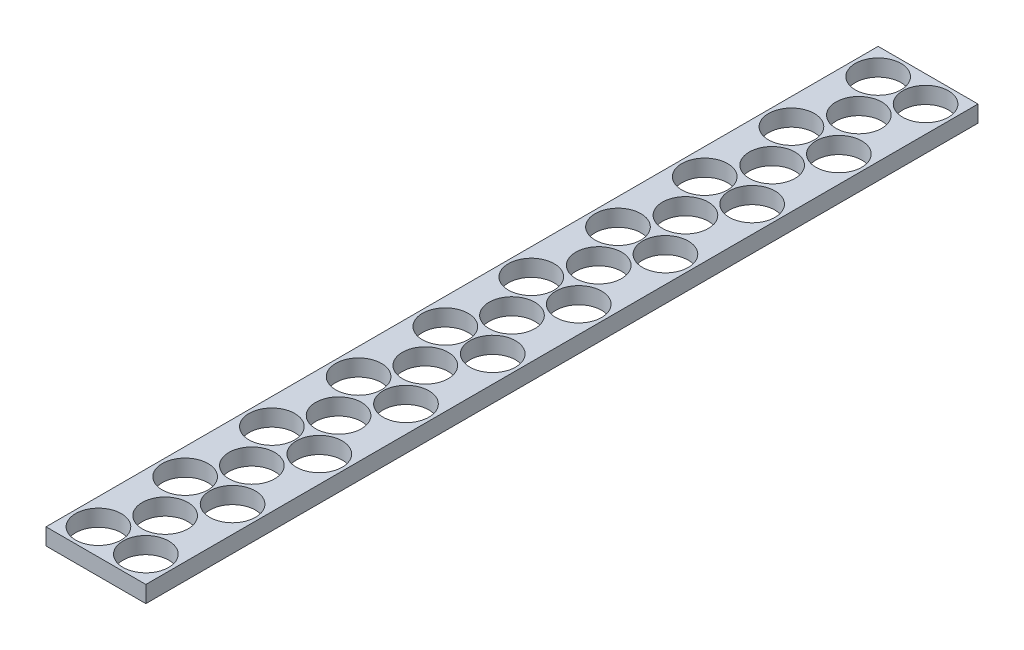
from build123d import *

# Parameters (mm, degrees)
SKETCH1_W           = 76.2
SKETCH1_H           = 12.7
BOSS_EXTRUDE1_DEPTH = 317.5
CUT_EXTRUDE1_REACH  = 322.03
SKETCH2_R           = 17.4625
LPATTERN1_COUNT     = 5
LPATTERN1_PITCH     = 66.173358604
MIRROR1_START       = -6.35
MIRROR1_OUTLINE_R   = 17.4625
MIRROR1_DEPTH       = 12.7


# Read off the part's stored shape, not the designer's step: Mirror1
with BuildPart() as part:
    # Sketch1 → Boss-Extrude1 (new, symmetric)
    with BuildSketch(Plane.XY):
        Rectangle(SKETCH1_W, SKETCH1_H)
    extrude(amount=BOSS_EXTRUDE1_DEPTH, both=True)

    # Sketch2 → Cut-Extrude1 (cut, up to next)
    with BuildSketch(Plane(origin=(0, 6.35, 0), x_dir=(1, 0, 0), z_dir=(0, 1, 0)), mode=Mode.PRIVATE) as cut_extrude1_sk1:
        with Locations(Location((-18.0975, -297.4975, 0), (0, 0, 180))):
            Circle(SKETCH2_R)
    cut_extrude1_tool1 = extrude(cut_extrude1_sk1.sketch, amount=-CUT_EXTRUDE1_REACH, mode=Mode.PRIVATE) & part.part
    # Sketch2 → Cut-Extrude1 (cut, up to next)
    with BuildSketch(Plane(origin=(0, 6.35, 0), x_dir=(1, 0, 0), z_dir=(0, 1, 0)), mode=Mode.PRIVATE) as cut_extrude1_sk2:
        with Locations(Location((0, -264.693434417, 0), (0, 0, 180))):
            Circle(SKETCH2_R)
    cut_extrude1_tool2 = extrude(cut_extrude1_sk2.sketch, amount=-CUT_EXTRUDE1_REACH, mode=Mode.PRIVATE) & part.part
    # Sketch2 → Cut-Extrude1 (cut, up to next)
    with BuildSketch(Plane(origin=(0, 6.35, 0), x_dir=(1, 0, 0), z_dir=(0, 1, 0)), mode=Mode.PRIVATE) as cut_extrude1_sk3:
        with Locations(Location((18.0975, -297.4975, 0), (0, 0, 180))):
            Circle(SKETCH2_R)
    cut_extrude1_tool3 = extrude(cut_extrude1_sk3.sketch, amount=-CUT_EXTRUDE1_REACH, mode=Mode.PRIVATE) & part.part
    cut_extrude1_1 = cut_extrude1_tool1.solids().sort_by_distance((-18.0975, 6.35, 297.4975))[0]
    add(cut_extrude1_1, mode=Mode.SUBTRACT)
    cut_extrude1_2 = cut_extrude1_tool2.solids().sort_by_distance((0, 6.35, 264.693434))[0]
    add(cut_extrude1_2, mode=Mode.SUBTRACT)
    cut_extrude1_3 = cut_extrude1_tool3.solids().sort_by_distance((18.0975, 6.35, 297.4975))[0]
    add(cut_extrude1_3, mode=Mode.SUBTRACT)
    cut_extrude1 = cut_extrude1_1 + cut_extrude1_2 + cut_extrude1_3  # Cut-Extrude1 as one shape, for the pattern or mirror that repeats it

    # LPattern1: Cut-Extrude1 ×5
    with Locations(*[(0, 0, -i * LPATTERN1_PITCH) for i in range(1, LPATTERN1_COUNT)]):
        add(cut_extrude1, mode=Mode.SUBTRACT)

    # Mirror1 outline → Mirror1 (cut)
    with BuildSketch(Plane(origin=(0, 0, 0), x_dir=(1, 0, 0), z_dir=(0, 1, 0)).offset(MIRROR1_START)):
        with Locations((-18.0975, 297.4975)):
            Circle(MIRROR1_OUTLINE_R)
        with Locations((-18.0975, 32.804065583)):
            Circle(MIRROR1_OUTLINE_R)
        with Locations((18.0975, 98.977424187)):
            Circle(MIRROR1_OUTLINE_R)
        with Locations((-18.0975, 98.977424187)):
            Circle(MIRROR1_OUTLINE_R)
        with Locations((0, 66.173358604)):
            Circle(MIRROR1_OUTLINE_R)
        with Locations((18.0975, 32.804065583)):
            Circle(MIRROR1_OUTLINE_R)
        with Locations((-18.0975, 231.324141396)):
            Circle(MIRROR1_OUTLINE_R)
        with Locations((0, 198.520075813)):
            Circle(MIRROR1_OUTLINE_R)
        with Locations((0, 264.693434417)):
            Circle(MIRROR1_OUTLINE_R)
        with Locations((18.0975, 297.4975)):
            Circle(MIRROR1_OUTLINE_R)
        with Locations((0, 132.346717209)):
            Circle(MIRROR1_OUTLINE_R)
        with Locations((18.0975, 165.150782791)):
            Circle(MIRROR1_OUTLINE_R)
        with Locations((-18.0975, 165.150782791)):
            Circle(MIRROR1_OUTLINE_R)
        with Locations((18.0975, 231.324141396)):
            Circle(MIRROR1_OUTLINE_R)
    extrude(amount=MIRROR1_DEPTH, mode=Mode.SUBTRACT)


solid = part.part
